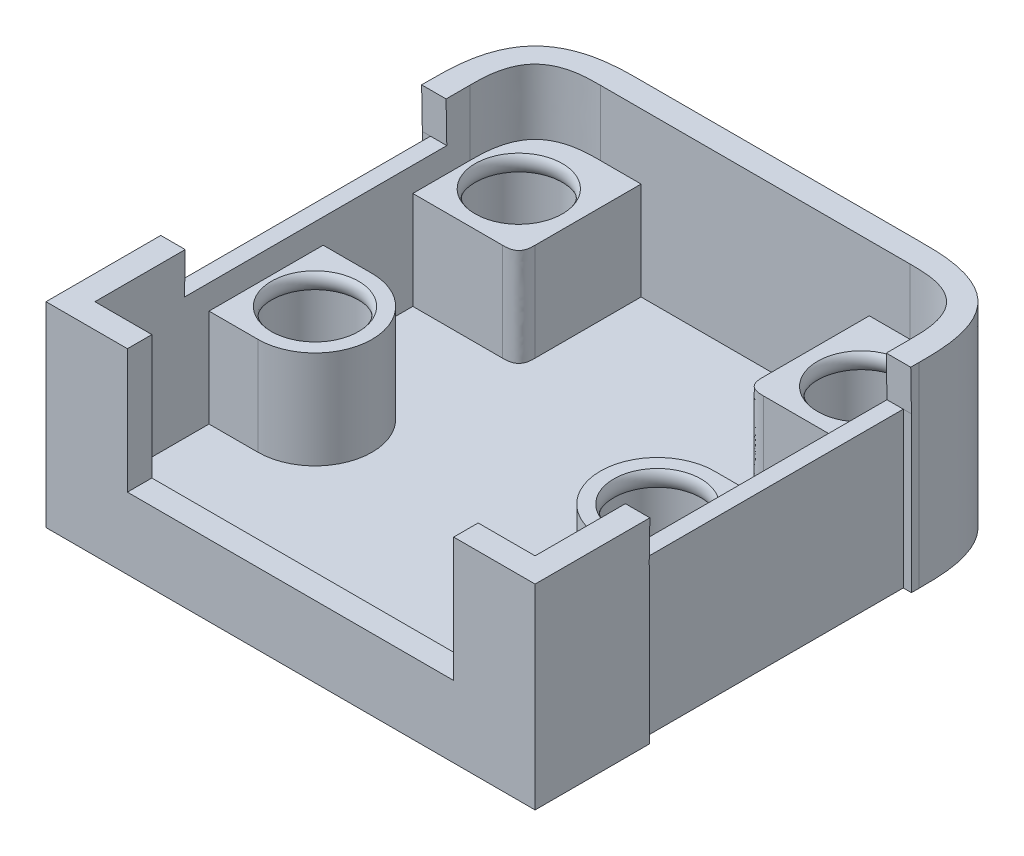
from build123d import *

# Parameters (mm, degrees)
SKETCH1_W            = 30.000000000000004
SKETCH1_H            = 30.000000000000004
BOSS_EXTRUDE3_DEPTH  = 12
SKETCH2_W            = 26.999999999999993
SKETCH2_H            = 27.000000000000007
CUT_EXTRUDE1_DEPTH   = 10
FILLET1_START        = -1
FILLET1_DEPTH        = 13
FILLET1_START_2      = 1.13256
FILLET1_2_DEPTH      = 10.86744
CUT_EXTRUDE2_DEPTH   = 2.5
CUT_EXTRUDE2_DRAFT   = 1.0000000000000042
MIRROR1_COPY_1_DEPTH = 2.5
MIRROR1_COPY_1_DRAFT = 1.0000000000000042
CUT_EXTRUDE3_DEPTH   = 7.62
SKETCH6_R            = 2.6750000000000007
BOSS_EXTRUDE4_DEPTH  = 6
SKETCH6_2_R          = 2.6750000000000007
BOSS_EXTRUDE5_DEPTH  = 0.5
CUT_EXTRUDE4_REACH   = 26.372
FILLET2_SIZE         = 1


with BuildPart() as part:
    # Sketch1 → Boss-Extrude3 (new body)
    with BuildSketch(Plane(origin=(0, 0, 0), x_dir=(1, 0, 0), z_dir=(0, 1, 0))):
        Rectangle(SKETCH1_W, SKETCH1_H)
    extrude(amount=BOSS_EXTRUDE3_DEPTH)

    # Sketch2 → Cut-Extrude1 (cut)
    with BuildSketch(Plane(origin=(0, 12, 0), x_dir=(1, 0, 0), z_dir=(0, 1, 0))):
        Rectangle(SKETCH2_W, SKETCH2_H)
    extrude(amount=-CUT_EXTRUDE1_DEPTH, mode=Mode.SUBTRACT)

    # Fillet1: read off the stored shape, not the designer's step
    # Fillet1 outline → Fillet1 (cut)
    with BuildSketch(Plane(origin=(0, 0, 0), x_dir=(1, 0, 0), z_dir=(0, 1, 0)).offset(FILLET1_START)):
        with BuildLine():
            Line((-8.55, 15), (8.55, 15))
            add(Edge.make_bspline(
                [(8.55, 15), (9.63487743239395, 15), (10.7197548647879, 15), (13.1108387386532, 14.5375871170573), (14.5375871170573, 13.1108387386532), (15, 10.7197548647879), (15, 9.63487743239395), (15, 8.55)],
                knots=[0, 0, 0, 0, 0, 0, 0.5, 0.5, 1, 1, 1, 1, 1, 1], degree=5))
            Line((15, 8.55), (15, 7))
            Line((15, 7), (17, 7))
            Line((17, 7), (17, 17))
            Line((17, 17), (-17, 17))
            Line((-17, 17), (-17, 7))
            Line((-17, 7), (-15, 7))
            Line((-15, 7), (-15, 8.55))
            add(Edge.make_bspline(
                [(-15, 8.55), (-15, 9.63487743239395), (-15, 10.7197548647879), (-14.5375871170573, 13.1108387386532), (-13.1108387386532, 14.5375871170573), (-10.7197548647879, 15), (-9.63487743239395, 15), (-8.55, 15)],
                knots=[0, 0, 0, 0, 0, 0, 0.5, 0.5, 1, 1, 1, 1, 1, 1], degree=5))
        make_face()
    extrude(amount=FILLET1_DEPTH, mode=Mode.SUBTRACT)

    # Fillet1 2 outline → Fillet1 2 (add)
    with BuildSketch(Plane(origin=(0, 0, 0), x_dir=(1, 0, 0), z_dir=(0, 1, 0)).offset(FILLET1_START_2)):
        with BuildLine():
            add(Edge.make_bspline(
                [(8.55, 15), (9.63487743239395, 15), (10.7197548647879, 15), (13.1108387386532, 14.5375871170573), (14.5375871170573, 13.1108387386532), (15, 10.7197548647879), (15, 9.63487743239395), (15, 8.55)],
                knots=[0, 0, 0, 0, 0, 0, 0.5, 0.5, 1, 1, 1, 1, 1, 1], degree=5))
            Line((8.55, 15), (-8.55, 15))
            add(Edge.make_bspline(
                [(-15, 8.55), (-15, 9.63487743239395), (-15, 10.7197548647879), (-14.5375871170573, 13.1108387386532), (-13.1108387386532, 14.5375871170573), (-10.7197548647879, 15), (-9.63487743239395, 15), (-8.55, 15)],
                knots=[0, 0, 0, 0, 0, 0, 0.5, 0.5, 1, 1, 1, 1, 1, 1], degree=5))
            Line((-15, 8.55), (-15, 7))
            Line((-15, 7), (-13.5, 7))
            Line((-13.5, 7), (-13.5, 9.5))
            add(Edge.make_bspline(
                [(-9.5, 13.5), (-10.1727922061358, 13.5), (-10.8455844122716, 13.5), (-12.3284271247462, 13.2132323206557), (-13.2132323206557, 12.3284271247462), (-13.5, 10.8455844122716), (-13.5, 10.1727922061358), (-13.5, 9.5)],
                knots=[0, 0, 0, 0, 0, 0, 0.5, 0.5, 1, 1, 1, 1, 1, 1], degree=5))
            Line((-9.5, 13.5), (9.5, 13.5))
            add(Edge.make_bspline(
                [(13.5, 9.5), (13.5, 10.1727922061358), (13.5, 10.8455844122716), (13.2132323206557, 12.3284271247462), (12.3284271247462, 13.2132323206557), (10.8455844122716, 13.5), (10.1727922061358, 13.5), (9.5, 13.5)],
                knots=[0, 0, 0, 0, 0, 0, 0.5, 0.5, 1, 1, 1, 1, 1, 1], degree=5))
            Line((13.5, 9.5), (13.5, 7))
            Line((13.5, 7), (15, 7))
            Line((15, 7), (15, 8.55))
        make_face()
    extrude(amount=FILLET1_2_DEPTH)


with BuildPart() as cut_extrude2_tool:
    # Sketch3 → Cut-Extrude2 (with draft: the straight prism first)
    with BuildSketch(Plane(origin=(0, 12, 0), x_dir=(1, 0, 0), z_dir=(0, 1, 0))):
        Polygon((-15.000000000000002, 8.040000000000003), (-14.999999999999998, -7.959999999999998), (-13.499999999999986, -7.959999999999998), (-13.499999999999988, 8.040000000000003), align=None)
    extrude(amount=-CUT_EXTRUDE2_DEPTH)
    # Cut-Extrude2: the draft: its side faces are tilted about the plane it starts from
    cut_extrude2_sides = [cut_extrude2_tool.faces().sort_by_distance(p)[0] for p in [
        (-15, 10.75, -0.04),
        (-14.25, 10.75, 7.96),
        (-13.5, 10.75, -0.04),
        (-14.25, 10.75, -8.04),
    ]]
    draft(cut_extrude2_sides, Plane(origin=(0, 12, 0), x_dir=(1, 0, 0), z_dir=(0, 1, 0)), CUT_EXTRUDE2_DRAFT)


with BuildPart() as part_1:
    add(part.part)

    # Cut-Extrude2: cut by cut_extrude2_tool
    add(cut_extrude2_tool.part, mode=Mode.SUBTRACT)


with BuildPart() as mirror1_copy_1_tool:
    # Mirror1 copy 1 sketch → Mirror1 copy 1 (with draft: the straight prism first)
    with BuildSketch(Plane(origin=(0, 12, 0), x_dir=(-1, 0, 0), z_dir=(0, 1, 0))):
        Polygon((-15.000000000000002, -8.040000000000003), (-14.999999999999998, 7.959999999999998), (-13.499999999999986, 7.959999999999998), (-13.499999999999988, -8.040000000000003), align=None)
    extrude(amount=-MIRROR1_COPY_1_DEPTH)
    # Mirror1 copy 1: the draft: its side faces are tilted about the plane it starts from
    mirror1_copy_1_sides = [mirror1_copy_1_tool.faces().sort_by_distance(p)[0] for p in [
        (15, 10.75, -0.04),
        (14.25, 10.75, 7.96),
        (13.5, 10.75, -0.04),
        (14.25, 10.75, -8.04),
    ]]
    draft(mirror1_copy_1_sides, Plane(origin=(0, 12, 0), x_dir=(-1, 0, 0), z_dir=(0, 1, 0)), MIRROR1_COPY_1_DRAFT)


with BuildPart() as part_2:
    add(part_1.part)

    # Mirror1 copy 1: cut by mirror1_copy_1_tool
    add(mirror1_copy_1_tool.part, mode=Mode.SUBTRACT)

    # Sketch5 → Cut-Extrude3 (cut)
    with BuildSketch(Plane(origin=(0, 12, 0), x_dir=(1, 0, 0), z_dir=(0, 1, 0))):
        Polygon((-10.006699639770744, -14.999999999999998), (10.006699639770742, -14.999999999999998), (10.006699639770742, -13.5), (-10.006699639770742, -13.500000000000002), align=None)
    extrude(amount=-CUT_EXTRUDE3_DEPTH, mode=Mode.SUBTRACT)

    # Sketch6 → Boss-Extrude4 (add)
    # profile 1 of 2: a face of its own
    with BuildSketch(Plane(origin=(0, 2, 0), x_dir=(1, 0, 0), z_dir=(0, 1, 0))):
        with BuildLine():
            Line((10.49999999999986, -6.5), (13.5, -6.5))
            Line((13.5, -6.5), (13.5, 0.5000000000000004))
            Line((13.5, 0.5000000000000004), (10.49999999999986, 0.5000000000000004))
            ThreePointArc((10.49999999999986, 0.5000000000000004), (6.99999999999986, -3), (10.49999999999986, -6.5))
        make_face()
        with Locations(Location((10.49999999999986, -2.9999999999999996, 0), (0, 0, 270))):
            Circle(SKETCH6_R, mode=Mode.SUBTRACT)
    # profile 2 of 2: a face of its own
    with BuildSketch(Plane(origin=(0, 2, 0), x_dir=(1, 0, 0), z_dir=(0, 1, 0))):
        Polygon((13.5, 9.500000000000004), (13.5, 6.0000000000000036), (7, 6.000000000000003), (7, 13.500000000000004), (13.5, 13.500000000000004), align=None)
        with Locations(Location((10.49999999999986, 9.5, 0), (0, 0, 270))):
            Circle(SKETCH6_R, mode=Mode.SUBTRACT)
    boss_extrude4 = extrude(amount=BOSS_EXTRUDE4_DEPTH)

    # Sketch6<2> → Boss-Extrude5 (add)
    with BuildSketch(Plane(origin=(0, 2, 0), x_dir=(1, 0, 0), z_dir=(0, 1, 0))):
        with Locations(Location((10.49999999999986, 9.5, 0), (0, 0, 270))):
            Circle(SKETCH6_2_R)
        with Locations(Location((10.49999999999986, -2.9999999999999996, 0), (0, 0, 270))):
            Circle(SKETCH6_2_R)
    boss_extrude5 = extrude(amount=BOSS_EXTRUDE5_DEPTH)

    # Cut-Extrude4: up to this face of the body (flat: up to its plane)
    cut_extrude4_end = Plane(part_2.part.faces().sort_by_distance((-14.25, 9.5, -0.04))[0])
    # Sketch13 → Cut-Extrude4 (cut, up to the picked face)
    with BuildSketch(Plane(origin=(0, 0, 0), x_dir=(-1, 0, 0), z_dir=(0, -1, 0)), mode=Mode.PRIVATE) as cut_extrude4_sk1:
        Polygon((14.999999999999998, -7.99636233767945), (14.499999999999996, -7.99636233767945), (14.5, 8.083637662320546), (15, 8.083637662320546), align=None)
    cut_extrude4_tool1 = split(extrude(cut_extrude4_sk1.sketch, amount=-CUT_EXTRUDE4_REACH, mode=Mode.PRIVATE), bisect_by=cut_extrude4_end, keep=Keep.BOTH, mode=Mode.PRIVATE)
    cut_extrude4 = cut_extrude4_tool1.solids().sort_by(Axis((-14.75, 0, -0.043638), (0, 1, 0)))[0]
    add(cut_extrude4, mode=Mode.SUBTRACT)

    # Mirror2: Boss-Extrude4, Boss-Extrude5, Cut-Extrude4 across plane
    add(boss_extrude4.mirror(Plane.ZY))
    add(boss_extrude5.mirror(Plane.ZY))
    add(cut_extrude4.mirror(Plane.ZY), mode=Mode.SUBTRACT)

    # Fillet2
    # a fillet whose section is not a circle: 1 mm, written as the material it takes off along each edge
    with BuildSketch(Plane(origin=(-7, 2, -6.000000000000003), x_dir=(-1, 0, 0), z_dir=(0, 1, 0))) as fillet2_piece_1:
        with BuildLine():
            add(Edge.make_bspline([(FILLET2_SIZE, 0), (FILLET2_SIZE * 0.831801948466, 0), (FILLET2_SIZE * 0.663603896932, 0), (FILLET2_SIZE * 0.292893218813, -FILLET2_SIZE * 0.0716919198361), (FILLET2_SIZE * 0.0716919198361, -FILLET2_SIZE * 0.292893218813), (0, -FILLET2_SIZE * 0.663603896932), (0, -FILLET2_SIZE * 0.831801948466), (0, -FILLET2_SIZE)], knots=[0, 0, 0, 0, 0, 0, 0.5, 0.5, 1, 1, 1, 1, 1, 1], degree=5))
            Line((0, -FILLET2_SIZE), (0, 0))
            Line((0, 0), (FILLET2_SIZE, 0))
        make_face()
    extrude(amount=8.5, mode=Mode.SUBTRACT)
    with BuildSketch(Plane(origin=(7, 2, -6.000000000000003), x_dir=(1, 0, 0), z_dir=(0, 1, 0))) as fillet2_piece_2:
        with BuildLine():
            add(Edge.make_bspline([(FILLET2_SIZE, 0), (FILLET2_SIZE * 0.831801948466, 0), (FILLET2_SIZE * 0.663603896932, 0), (FILLET2_SIZE * 0.292893218813, FILLET2_SIZE * 0.0716919198361), (FILLET2_SIZE * 0.0716919198361, FILLET2_SIZE * 0.292893218813), (0, FILLET2_SIZE * 0.663603896932), (0, FILLET2_SIZE * 0.831801948466), (0, FILLET2_SIZE)], knots=[0, 0, 0, 0, 0, 0, 0.5, 0.5, 1, 1, 1, 1, 1, 1], degree=5))
            Line((0, FILLET2_SIZE), (0, 0))
            Line((0, 0), (FILLET2_SIZE, 0))
        make_face()
    extrude(amount=8.5, mode=Mode.SUBTRACT)

    # Sketch9 → Revolve1 (revolve)
    with BuildSketch(Plane(origin=(-12.240866923994627, 8, -7.468988588672871), x_dir=(-0.6507913734559867, 0, 0.7592566023652811), z_dir=(-0.7592566023652811, 0, -0.6507913734559867)), mode=Mode.PRIVATE) as revolve1_sk:
        with BuildLine():
            Line((0, -1), (0, 0))
            ThreePointArc((0, 0), (-0.17693514578671132, -0.4999999999999999), (0, -1))
        make_face()
    revolve(revolve1_sk.sketch.rotate(Axis((-10.49999999999986, 19.424716620639604, -9.5), (0, -1, 0)), 319.398705355), axis=Axis((-10.49999999999986, 19.424716620639604, -9.5), (0, -1, 0)))

    # Sketch10 → Revolve2 (revolve)
    with BuildSketch(Plane(origin=(12.240866923994627, 8, -7.468988588672871), x_dir=(-0.6507913734559867, 0, -0.7592566023652811), z_dir=(0.7592566023652811, 0, -0.6507913734559867)), mode=Mode.PRIVATE) as revolve2_sk:
        with BuildLine():
            Line((0, -1), (0, 0))
            ThreePointArc((0, 0), (0.19685183327597433, -0.5), (0, -1))
        make_face()
    revolve(revolve2_sk.sketch.rotate(Axis((10.49999999999986, 19.424716620639604, -9.5), (0, -1, 0)), 40.601294645), axis=Axis((10.49999999999986, 19.424716620639604, -9.5), (0, -1, 0)))

    # Sketch11 → Revolve3 (revolve)
    with BuildSketch(Plane(origin=(-12.240866923994624, 8, 5.031011411327126), x_dir=(-0.650791373455986, 0, 0.7592566023652817), z_dir=(-0.7592566023652816, 0, -0.6507913734559859)), mode=Mode.PRIVATE) as revolve3_sk:
        with BuildLine():
            Line((0, 0), (1.2e-16, -1))
            ThreePointArc((1.2e-16, -1), (-0.20710678118654702, -0.4999999999999998), (0, 0))
        make_face()
    revolve(revolve3_sk.sketch.rotate(Axis((-10.49999999999986, 19.424716620639604, 2.9999999999999996), (0, -1, 0)), 319.398705355), axis=Axis((-10.49999999999986, 19.424716620639604, 2.9999999999999996), (0, -1, 0)))

    # Sketch12 → Revolve4 (revolve)
    with BuildSketch(Plane(origin=(12.240866923994624, 8, 5.031011411327126), x_dir=(-0.650791373455986, 0, -0.7592566023652817), z_dir=(0.7592566023652816, 0, -0.6507913734559859)), mode=Mode.PRIVATE) as revolve4_sk:
        with BuildLine():
            Line((0, -1), (0, 0))
            ThreePointArc((0, 0), (0.16237280325092585, -0.5), (0, -1))
        make_face()
    revolve(revolve4_sk.sketch.rotate(Axis((10.49999999999986, 19.424716620639604, 2.9999999999999996), (0, -1, 0)), 40.601294645), axis=Axis((10.49999999999986, 19.424716620639604, 2.9999999999999996), (0, -1, 0)))


solid = part_2.part
